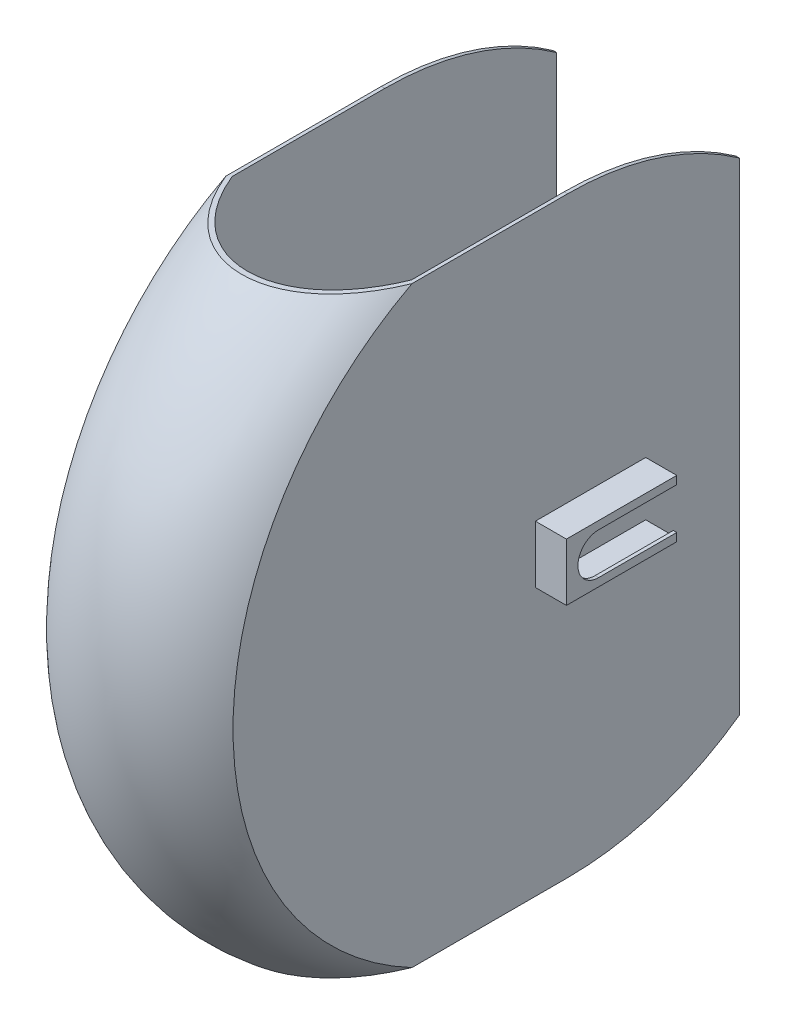
from build123d import *
from build123d.topology import SkipClean

# Parameters (mm, degrees)
SKETCH1_W               = 24
SKETCH1_H               = 3
SKETCH1_W_2             = 3
SKETCH1_H_2             = 50
BOSS_EXTRUDE1_DEPTH     = 93.000002671
CUT_EXTRUDE1_DEPTH      = 140.210775357
CUT_EXTRUDE1_DEPTH_BACK = 93
SKETCH3_W               = 27
SKETCH3_H               = 3
BOSS_EXTRUDE2_DEPTH     = 3
SKETCH4_W               = 27
SKETCH4_H               = 3
BOSS_EXTRUDE3_DEPTH     = 47
BOSS_EXTRUDE6_DEPTH     = 3
REVOLVE4_ANGLE          = 125.433735


# Read off the part's stored shape, not the designer's step: Revolve4
with BuildPart() as part:
    # Sketch1 → Boss-Extrude1 (new body)
    with BuildSketch(Plane.XY):
        with Locations((-62.932805134, -98.508197058)):
            Rectangle(SKETCH1_W, SKETCH1_H)
        with Locations((-49.432805134, -75.008197058)):
            Rectangle(SKETCH1_W_2, SKETCH1_H_2)
        with Locations((-62.932805134, -51.508197058)):
            Rectangle(SKETCH1_W, SKETCH1_H)
    extrude(amount=-BOSS_EXTRUDE1_DEPTH)

    # Sketch2 → Cut-Extrude1 (cut, two sides: drawn at the far end of the back side and taken through both)
    with BuildSketch(Plane(origin=(-47.932805134, 0, 0), x_dir=(0, 0, -1), z_dir=(1, 0, 0)).offset(-CUT_EXTRUDE1_DEPTH_BACK)):
        with BuildLine():
            Line((25.000000095, -93.008197058), (93.000002671, -93.008197058))
            Line((93.000002671, -93.008197058), (93.000002671, -57.008197058))
            Line((93.000002671, -57.008197058), (25.000000095, -57.008197058))
            ThreePointArc((25.000000095, -57.008197058), (7.000000095, -75.008197058), (25.000000095, -93.008197058))
        make_face()
    extrude(amount=CUT_EXTRUDE1_DEPTH + CUT_EXTRUDE1_DEPTH_BACK, mode=Mode.SUBTRACT)

    # Sketch3 → Boss-Extrude2 (add)
    with BuildSketch(Plane.XY):
        with Locations((-61.432805134, -51.508197058)):
            Rectangle(SKETCH3_W, SKETCH3_H)
    extrude(amount=BOSS_EXTRUDE2_DEPTH)

    # Sketch4 → Boss-Extrude3 (add)
    with BuildSketch(Plane.XZ.offset(53.008197058)):
        with Locations((-61.432805134, 1.5)):
            Rectangle(SKETCH4_W, SKETCH4_H)
    extrude(amount=BOSS_EXTRUDE3_DEPTH)

    # Sketch7 → Boss-Extrude6 (add)
    with BuildSketch(Plane(origin=(-74.932805134, 0, 0), x_dir=(0, 0, -1), z_dir=(1, 0, 0))):
        with BuildLine():
            Line((174.428746291, -285.008197058), (174.428746291, -75.008197058))
            Line((174.428746291, -75.008197058), (-264.999999905, -75.008197058))
            ThreePointArc((-264.999999905, -75.008197058), (-222.639279178, -225.921375281), (-107.932500861, -332.746339733))
            Line((-107.932500861, -332.746339733), (25.000000095, -332.746339733))
            ThreePointArc((25.000000095, -332.746339733), (103.434495784, -320.52190355), (174.428746291, -285.008197058))
        make_face()
        with BuildLine():
            Line((174.428746291, -75.008197058), (174.428746291, 134.991802942))
            ThreePointArc((174.428746291, 134.991802942), (103.434495784, 170.505509435), (25.000000095, 182.729945617))
            Line((25.000000095, 182.729945617), (-107.932500861, 182.729945617))
            ThreePointArc((-107.932500861, 182.729945617), (-222.639279178, 75.904981165), (-264.999999905, -75.008197058))
            Line((-264.999999905, -75.008197058), (174.428746291, -75.008197058))
        make_face()
    extrude(amount=-BOSS_EXTRUDE6_DEPTH)

    # Revolve4 outline → Revolve4 (revolve)
    with SkipClean():  # the faces are left unmerged after this step: merging them gives an invalid solid
        with BuildSketch(Plane(origin=(0, -75.008197058, -25.000000095), x_dir=(0, 0.8887522161208324, 0.4583879343310741), z_dir=(0, 0.4583879343310741, -0.8887522161208324))):
            with BuildLine():
                ThreePointArc((290, -77.932805134), (315.708726362, -113.226368872), (324.804580053, -155.932805134))
                Line((324.804580053, -155.932805134), (327.804580053, -155.932805134))
                ThreePointArc((327.804580053, -155.932805134), (318.21148268, -111.476847715), (291.139493113, -74.932805134))
                Line((291.139493113, -74.932805134), (290, -74.932805134))
                Line((290, -74.932805134), (290, -77.932805134))
            make_face()
        revolve(axis=Axis((0, -75.008197058, -25.000000095), (1, 0, 0)), revolution_arc=REVOLVE4_ANGLE)

    # SurfaceCut4
    split(bisect_by=Plane(origin=(0, -332.746339733, 0), x_dir=(-1, 0, 0), z_dir=(0, -1, 0)), keep=Keep.BOTTOM)

    # SurfaceCut6
    split(bisect_by=Plane(origin=(0, 182.729945617, 0), x_dir=(1, 0, 0), z_dir=(0, 1, 0)), keep=Keep.BOTTOM)

    # Mirror6: part across plane


with BuildPart() as part_1:
    add(part.part)
    add(part.part.mirror(Plane(origin=(-155.932805134, 0, 0), x_dir=(0, 0, 1), z_dir=(1, 0, 0))))


solid = part_1.part
